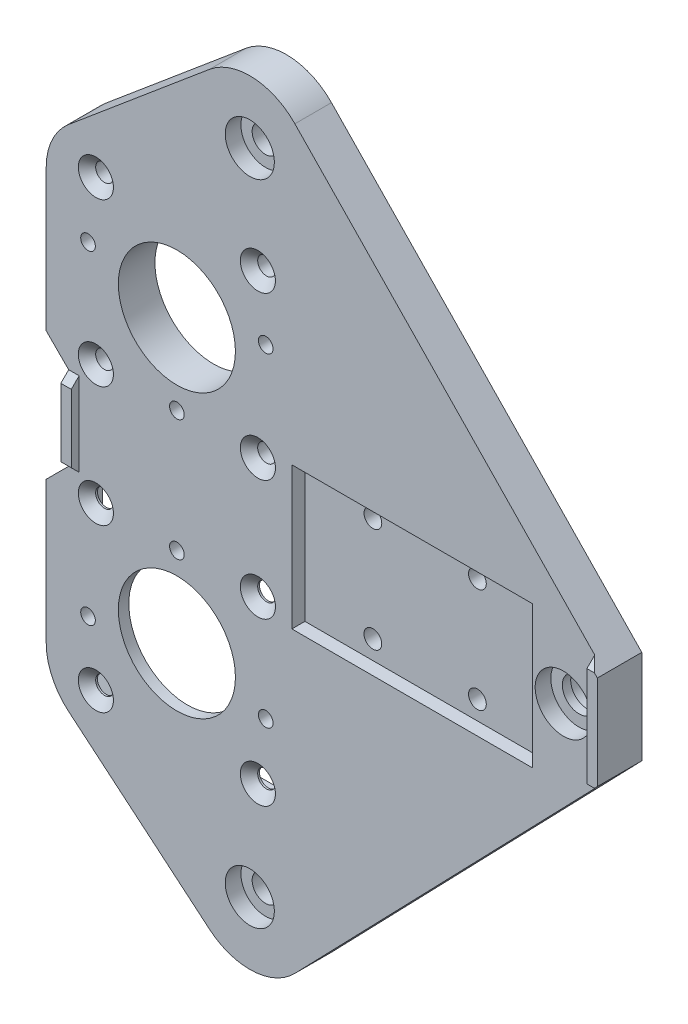
from build123d import *

# Parameters (mm, degrees)
BOSS_EXTRUDE1_DEPTH                = 7
BOSS_EXTRUDE2_DEPTH                = 1.5
SKETCH29_W                         = 6.05
SKETCH29_H                         = 18.000820755
CUT_EXTRUDE6_DEPTH                 = 114.767548097
CUT_EXTRUDE1_DEPTH                 = 111.671608825
CUT_EXTRUDE1_DEPTH_BACK            = 111.671608825
SKETCH3_R                          = 11.2
CUT_EXTRUDE3_START                 = -5
CUT_EXTRUDE3_DEPTH                 = 5
SKETCH8_W                          = 46
SKETCH8_H                          = 27.2
CUT_EXTRUDE4_DEPTH                 = 2.5
CUT_EXTRUDE5_START                 = -2.4
SKETCH16_R                         = 3.6
CUT_EXTRUDE5_DEPTH                 = 2.4
CUT_EXTRUDE7_DEPTH                 = 111.776599515
SKETCH32_W                         = 1.5
SKETCH32_H                         = 16
BOSS_EXTRUDE3_DEPTH                = 2
CUT_EXTRUDE8_DEPTH                 = 129.7251141
CUT_EXTRUDE9_REACH                 = 128.86
CSK_FOR_M3_SFHCS1_D                = 3.4
CSK_FOR_M3_SFHCS1_CSINK_D          = 6.72
CSK_FOR_M3_SFHCS1_CSINK_ANGLE      = 90
M3_CLEARANCE_HOLE1_D               = 3.4
CBORE_START                        = 4
CBORE_FOR_M5_SHCS1_OUTLINE_R       = 5.4
CBORE_FOR_M5_SHCS1_DEPTH           = 3
CBORE_START_2                      = 2.4
CBORE_FOR_M5_SHCS1_2_OUTLINE_R     = 3.2
CBORE_FOR_M5_SHCS1_2_DEPTH         = 1.6
CBORE_FOR_M5_SBHCS1_OUTLINE_R      = 4.7
CBORE_FOR_M5_SBHCS1_DEPTH          = 3
CBORE_FOR_M5_SBHCS1_2_OUTLINE_R    = 2.55
CBORE_FOR_M5_SBHCS1_2_DEPTH        = 4
F_2_8_2_8_DIAMETER_HOLE1_OUTLINE_R = 1.4
F_2_8_2_8_DIAMETER_HOLE1_DEPTH     = 7


# Read off the part's stored shape, not the designer's step: CBORE for M5 SHCS1, CBORE for M5 SBHCS1, Ø2.8 (2.8) Diameter Hole1
with BuildPart() as part:
    # Sketch1 → Boss-Extrude1 (new body)
    with BuildSketch(Plane.XY):
        with BuildLine():
            Line((-25, -39.43626494), (-25, 39.43626494))
            ThreePointArc((-25, 39.43626494), (-23.875693444, 44.507684081), (-20.713451316, 48.628798257))
            Line((-20.713451316, 48.628798257), (6.236548684, 71.242533317))
            ThreePointArc((6.236548684, 71.242533317), (14.574085994, 74.03376054), (22.576586736, 70.391582661))
            Line((22.576586736, 70.391582661), (82.576586736, 8.341582661))
            ThreePointArc((82.576586736, 8.341582661), (85.95, 0), (82.576586736, -8.341582661))
            Line((82.576586736, -8.341582661), (22.576586736, -70.391582661))
            ThreePointArc((22.576586736, -70.391582661), (14.574085994, -74.03376054), (6.236548684, -71.242533317))
            Line((6.236548684, -71.242533317), (-20.713451316, -48.628798257))
            ThreePointArc((-20.713451316, -48.628798257), (-23.875693444, -44.507684081), (-25, -39.43626494))
        make_face()
    extrude(amount=BOSS_EXTRUDE1_DEPTH)

    # Sketch30 → Boss-Extrude2 (add)
    with BuildSketch(Plane.XY.offset(7)):
        with BuildLine():
            Line((79.95, 11.05791111), (79.95, -11.05791111))
            Line((79.95, -11.05791111), (82.576586736, -8.341582661))
            ThreePointArc((82.576586736, -8.341582661), (85.95, 0), (82.576586736, 8.341582661))
            Line((82.576586736, 8.341582661), (79.95, 11.05791111))
        make_face()
    extrude(amount=BOSS_EXTRUDE2_DEPTH)

    # Sketch29 → Cut-Extrude6 (cut, through all)
    with BuildSketch(Plane.XY.offset(8.5)):
        with Locations((84.975, 0.0108326)):
            Rectangle(SKETCH29_W, SKETCH29_H)
    extrude(amount=-CUT_EXTRUDE6_DEPTH, mode=Mode.SUBTRACT)

    # Sketch3 → Cut-Extrude1 (cut, two sides: drawn at the far end of the back side and taken through both)
    with BuildSketch(Plane.XY.offset(7).offset(-CUT_EXTRUDE1_DEPTH_BACK)):
        with Locations((0, 27)):
            Circle(SKETCH3_R)
        with Locations((0, -27)):
            Circle(SKETCH3_R)
    extrude(amount=CUT_EXTRUDE1_DEPTH + CUT_EXTRUDE1_DEPTH_BACK, mode=Mode.SUBTRACT)

    # Sketch6 → Cut-Extrude3 (cut)
    with BuildSketch(Plane(origin=(0, 0, 0), x_dir=(-1, 0, 0), z_dir=(0, 0, -1)).offset(CUT_EXTRUDE3_START)):
        Polygon((21.2, -9.910167799), (17.089832201, -5.8), (-17.089832201, -5.8), (-21.2, -9.910167799), (-21.2, -44.089832201), (-17.089832201, -48.2), (17.089832201, -48.2), (21.2, -44.089832201), align=None)
    extrude(amount=CUT_EXTRUDE3_DEPTH, mode=Mode.SUBTRACT)

    # Sketch8 → Cut-Extrude4 (cut)
    with BuildSketch(Plane.XY.offset(7)):
        with Locations((45, 0)):
            Rectangle(SKETCH8_W, SKETCH8_H)
    extrude(amount=-CUT_EXTRUDE4_DEPTH, mode=Mode.SUBTRACT)

    # Sketch16 → Cut-Extrude5 (cut)
    with BuildSketch(Plane(origin=(0, 0, 0), x_dir=(-1, 0, 0), z_dir=(0, 0, -1)).offset(CUT_EXTRUDE5_START)):
        with Locations((-73.95, 0)):
            Circle(SKETCH16_R)
    extrude(amount=CUT_EXTRUDE5_DEPTH, mode=Mode.SUBTRACT)

    # Sketch31 → Cut-Extrude7 (cut, through all)
    with BuildSketch(Plane(origin=(0, 0, 0), x_dir=(-1, 0, 0), z_dir=(0, 0, -1))):
        Polygon((25, -12.295954236), (20.704045764, -8), (20.704045764, 8), (25, 12.295954236), align=None)
    extrude(amount=-CUT_EXTRUDE7_DEPTH, mode=Mode.SUBTRACT)

    # Sketch32 → Boss-Extrude3 (add)
    with BuildSketch(Plane.ZY.offset(20.704045764)):
        with Locations((7.75, 0)):
            Rectangle(SKETCH32_W, SKETCH32_H)
    extrude(amount=-BOSS_EXTRUDE3_DEPTH)

    # Sketch34 → Cut-Extrude8 (cut, through all)
    with BuildSketch(Plane.ZY.offset(-79.95)):
        Polygon((7, 11.05791111), (8.5, 9.55791111), (8.5, 11.05791111), align=None)
    cut_extrude8 = extrude(amount=-CUT_EXTRUDE8_DEPTH, mode=Mode.SUBTRACT)

    # Sketch35 → Cut-Extrude9 (cut, up to next)
    with BuildSketch(Plane.ZY.offset(20.704045764), mode=Mode.PRIVATE) as cut_extrude9_sk1:
        Polygon((7, 8), (8.5, 8), (8.5, 6.5), align=None)
    cut_extrude9_tool1 = extrude(cut_extrude9_sk1.sketch, amount=-CUT_EXTRUDE9_REACH, mode=Mode.PRIVATE) & part.part
    cut_extrude9 = cut_extrude9_tool1.solids().sort_by_distance((-20.704046, 7.5, 8))[0]
    add(cut_extrude9, mode=Mode.SUBTRACT)

    # Mirror2: Cut-Extrude8, Cut-Extrude9 across plane
    add(cut_extrude8.mirror(Plane.ZX), mode=Mode.SUBTRACT)
    add(cut_extrude9.mirror(Plane.ZX), mode=Mode.SUBTRACT)

    # CSK for M3 SFHCS1 (through all)
    with Locations(Plane.XY.offset(7)):
        with Locations((-15.5, 42.5), (15.5, 42.5), (-15.5, 11.5), (15.5, -42.5), (-15.5, -42.5), (-15.5, -11.5), (15.5, 11.5), (15.5, -11.5)):
            CounterSinkHole(CSK_FOR_M3_SFHCS1_D / 2, CSK_FOR_M3_SFHCS1_CSINK_D / 2, counter_sink_angle=CSK_FOR_M3_SFHCS1_CSINK_ANGLE)

    # M3 Clearance Hole1 (through all)
    with Locations(Plane.XY.offset(4.5)):
        with Locations((35, 10), (35, -10), (55, 10), (55, -10)):
            Hole(M3_CLEARANCE_HOLE1_D / 2)

    # CBORE for M5 SHCS1 outline → CBORE for M5 SHCS1 (cut)
    with BuildSketch(Plane.XY.offset(CBORE_START)):
        with Locations((73.95, 0)):
            Circle(CBORE_FOR_M5_SHCS1_OUTLINE_R)
    extrude(amount=CBORE_FOR_M5_SHCS1_DEPTH, mode=Mode.SUBTRACT)

    # CBORE for M5 SHCS1 2 outline → CBORE for M5 SHCS1 2 (cut)
    with BuildSketch(Plane.XY.offset(CBORE_START_2)):
        with Locations((73.95, 0)):
            Circle(CBORE_FOR_M5_SHCS1_2_OUTLINE_R)
    extrude(amount=CBORE_FOR_M5_SHCS1_2_DEPTH, mode=Mode.SUBTRACT)

    # CBORE for M5 SBHCS1 outline → CBORE for M5 SBHCS1 (cut)
    with BuildSketch(Plane.XY.offset(CBORE_START)):
        with Locations((13.95, -62.05)):
            Circle(CBORE_FOR_M5_SBHCS1_OUTLINE_R)
        with Locations((13.95, 62.05)):
            Circle(CBORE_FOR_M5_SBHCS1_OUTLINE_R)
    extrude(amount=CBORE_FOR_M5_SBHCS1_DEPTH, mode=Mode.SUBTRACT)

    # CBORE for M5 SBHCS1 2 outline → CBORE for M5 SBHCS1 2 (cut)
    with BuildSketch(Plane.XY):
        with Locations((13.95, -62.05)):
            Circle(CBORE_FOR_M5_SBHCS1_2_OUTLINE_R)
        with Locations((13.95, 62.05)):
            Circle(CBORE_FOR_M5_SBHCS1_2_OUTLINE_R)
    extrude(amount=CBORE_FOR_M5_SBHCS1_2_DEPTH, mode=Mode.SUBTRACT)

    # Ø2.8 (2.8) Diameter Hole1 outline → Ø2.8 (2.8) Diameter Hole1 (cut)
    with BuildSketch(Plane.XY):
        with Locations((17, 31)):
            Circle(F_2_8_2_8_DIAMETER_HOLE1_OUTLINE_R)
        with Locations((-17, 31)):
            Circle(F_2_8_2_8_DIAMETER_HOLE1_OUTLINE_R)
        with Locations((0, 11.604631616)):
            Circle(F_2_8_2_8_DIAMETER_HOLE1_OUTLINE_R)
    f_2_8_2_8_diameter_hole1 = extrude(amount=F_2_8_2_8_DIAMETER_HOLE1_DEPTH, mode=Mode.SUBTRACT)

    # Mirror1: Ø2.8 (2.8) Diameter Hole1 across plane
    add(f_2_8_2_8_diameter_hole1.mirror(Plane.ZX), mode=Mode.SUBTRACT)


solid = part.part
